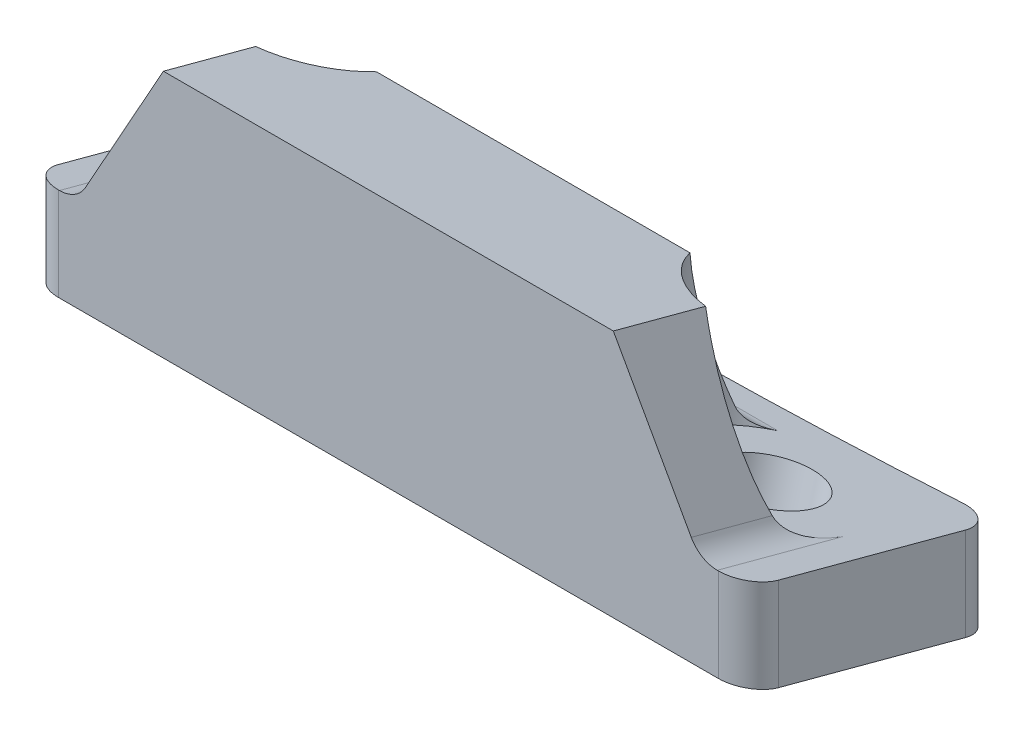
from build123d import *

# Parameters (mm, degrees)
BOSS_EXTRU_1_DEPTH            = 12
ESQUISSE2_R                   = 1.55
ENL_V_MAT_EXTRU_1_DEPTH       = 16.94179588
ENL_V_START                   = -3
ESQUISSE3_R                   = 3
ENL_V_MAT_EXTRU_2_DEPTH       = 25
ENL_V_MAT_EXTRU_3_DEPTH       = 16.94179588
ENL_V_MAT_EXTRU_3_DEPTH_BACK  = 16.94179588
ESQUISSE4_R                   = 125
ENL_V_START_2                 = -12
ENL_V_MAT_EXTRU_4_DEPTH       = 1.613248654
ENL_V_START_3                 = 10.386751346
ENL_V_MAT_EXTRU_4_2_DEPTH     = 1.613248654
ENL_V_START_4                 = -4.63527657
ENL_V_MAT_EXTRU_4_3_OUTLINE_W = 24
ENL_V_MAT_EXTRU_4_3_OUTLINE_H = 5
ENL_V_MAT_EXTRU_4_3_DEPTH     = 2.892118763
ENL_V_START_5                 = -1.893983464
ENL_V_MAT_EXTRU_4_4_DEPTH     = 8.893983464
ENL_V_START_6                 = -7.5
ENL_V_MAT_EXTRU_4_5_DEPTH     = 15
CONG_1_R                      = 1


with BuildPart() as part:
    # Esquisse1 → Boss.-Extru.1 (new, symmetric)
    with BuildSketch(Plane(origin=(0, 0, 0), x_dir=(0, 0, -1), z_dir=(1, 0, 0))):
        Polygon((-3.863703305, 1.03527618), (4.829629131, -1.294095226), (4.829629131, 6.988114218), (-3.863703305, 9.317485624), align=None)
    extrude(amount=BOSS_EXTRU_1_DEPTH, both=True)

    # Esquisse2 → Enlèv. mat.-Extru.1 (cut, through all)
    with BuildSketch(Plane(origin=(0, 0, 0), x_dir=(1, 0, 0), z_dir=(0, -0.9659258262890672, 0.2588190451025247))):
        with Locations(Location((-8, 0, 0), (0, 0, 270))):
            Circle(ESQUISSE2_R)
        with Locations(Location((8, 0, 0), (0, 0, 270))):
            Circle(ESQUISSE2_R)
    extrude(amount=-ENL_V_MAT_EXTRU_1_DEPTH, mode=Mode.SUBTRACT)

    # Esquisse3 → Enlèv. mat.-Extru.2 (cut)
    with BuildSketch(Plane(origin=(0, 0, 0), x_dir=(1, 0, 0), z_dir=(0, -0.9659258262890672, 0.2588190451025247)).offset(ENL_V_START)):
        with Locations(Location((-8, 0, 0), (0, 0, 270))):
            Circle(ESQUISSE3_R)
        with Locations(Location((8, 0, 0), (0, 0, 270))):
            Circle(ESQUISSE3_R)
    extrude(amount=-ENL_V_MAT_EXTRU_2_DEPTH, mode=Mode.SUBTRACT)

    # Esquisse4 → Enlèv. mat.-Extru.3 (cut, two sides: drawn at the far end of the back side and taken through both)
    with BuildSketch(Plane(origin=(0, 0, 0), x_dir=(1, 0, 0), z_dir=(0, 1, 0)).offset(-ENL_V_MAT_EXTRU_3_DEPTH_BACK)):
        with Locations((0, 128.9)):
            Circle(ESQUISSE4_R)
    extrude(amount=ENL_V_MAT_EXTRU_3_DEPTH + ENL_V_MAT_EXTRU_3_DEPTH_BACK, mode=Mode.SUBTRACT)

    # Enlèv. mat.-Extru.4: read off the stored shape, not the designer's step
    # Enlèv. mat.-Extru.4 outline → Enlèv. mat.-Extru.4 (cut)
    with BuildSketch(Plane.YZ.offset(ENL_V_START_2)):
        Polygon((9.317485624, 3.863703305), (4.141104722, 3.863703305), (2.44661504, -2.46021828), (8.023390398, -0.965925826), align=None)
    extrude(amount=ENL_V_MAT_EXTRU_4_DEPTH, mode=Mode.SUBTRACT)

    # Enl_v. mat.-Extru.4 2 outline → Enl_v. mat.-Extru.4 2 (cut)
    with BuildSketch(Plane.YZ.offset(ENL_V_START_3)):
        Polygon((9.317485624, 3.863703305), (4.141104722, 3.863703305), (2.44661504, -2.46021828), (8.023390398, -0.965925826), align=None)
    extrude(amount=ENL_V_MAT_EXTRU_4_2_DEPTH, mode=Mode.SUBTRACT)

    # Enl_v. mat.-Extru.4 3 outline → Enl_v. mat.-Extru.4 3 (cut)
    with BuildSketch(Plane(origin=(0, 0, 0), x_dir=(1, 0, 0), z_dir=(0, 0.25881904510252507, 0.9659258262890671)).offset(ENL_V_START_4)):
        with Locations((0, 5.5)):
            Rectangle(ENL_V_MAT_EXTRU_4_3_OUTLINE_W, ENL_V_MAT_EXTRU_4_3_OUTLINE_H)
    extrude(amount=ENL_V_MAT_EXTRU_4_3_DEPTH, mode=Mode.SUBTRACT)

    # Enl_v. mat.-Extru.4 4 outline → Enl_v. mat.-Extru.4 4 (cut)
    with BuildSketch(Plane(origin=(0, 0, 0), x_dir=(1, 0, 0), z_dir=(0, 0.25881904510252507, 0.9659258262890671)).offset(ENL_V_START_5)):
        Polygon((-12, 8), (-12, 3), (-10.386751346, 3), (-7.5, 8), align=None)
        Polygon((12, 8), (7.5, 8), (10.386751346, 3), (12, 3), align=None)
    extrude(amount=ENL_V_MAT_EXTRU_4_4_DEPTH, mode=Mode.SUBTRACT)

    # Enl_v. mat.-Extru.4 5 outline → Enl_v. mat.-Extru.4 5 (cut)
    with BuildSketch(Plane.YZ.offset(ENL_V_START_6)):
        Polygon((7.276244171, -3.754313506), (8.023390398, -0.965925826), (2.44661504, -2.46021828), align=None)
    extrude(amount=ENL_V_MAT_EXTRU_4_5_DEPTH, mode=Mode.SUBTRACT)

    # Congé1
    # the kernel refuses this fillet: 1 mm, written as the material it adds along each edge
    with BuildSketch(Plane(origin=(-10.386751346, 4.514677836, 5.257897145), x_dir=(-1, 0, 0), z_dir=(0, -0.2588190451454881, -0.9659258262775553))) as cong_1_piece_1_section:
        with BuildLine():
            CenterArc((CONG_1_R * 0.577350268999, CONG_1_R), CONG_1_R, 210, 60)
            Line((-CONG_1_R * 0.288675134782, CONG_1_R * 0.499999999993), (0, 0))
            Line((0, 0), (CONG_1_R * 0.577350268999, 0))
        make_face()
    cong_1_piece_1 = extrude(amount=5.873068178, mode=Mode.PRIVATE)
    cong_1_piece_1 = split(cong_1_piece_1, bisect_by=Plane(origin=(-10.386751346, 4.514677836, 3.863703305), z_dir=(0, 0, -1)), keep=Keep.TOP, mode=Mode.PRIVATE)
    cong_1_piece_1 = cong_1_piece_1 - Plane(origin=(-8, 2.897777479, -0.776457135), x_dir=(0, -0.25881904510252474, -0.9659258262890673), z_dir=(0, -0.9659258262890673, 0.25881904510252474)) * Cylinder(3, 15, mode=Mode.PRIVATE)
    add(cong_1_piece_1)
    with BuildSketch(Plane(origin=(-7.00177766, 2.44661504, -2.46021828), x_dir=(0, -0.2588190451025249, -0.9659258262890672), z_dir=(1, 0, 0))) as cong_1_piece_2_section:
        with BuildLine():
            CenterArc((CONG_1_R * 0.577350268769, CONG_1_R), CONG_1_R, 210.000000004, 59.999999996)
            Line((-CONG_1_R * 0.288675134977, CONG_1_R * 0.499999999934), (0, 0))
            Line((0, 0), (CONG_1_R * 0.577350268769, 0))
        make_face()
    cong_1_piece_2 = extrude(amount=14.003555319, mode=Mode.PRIVATE)
    cong_1_piece_2 = cong_1_piece_2 - Plane(origin=(-8, 2.897777479, -0.776457135), x_dir=(0, -0.25881904510252474, -0.9659258262890673), z_dir=(0, -0.9659258262890673, 0.25881904510252474)) * Cylinder(3, 31, mode=Mode.PRIVATE)
    cong_1_piece_2 = cong_1_piece_2 - Plane(origin=(8, 2.897777479, -0.776457135), x_dir=(0, -0.25881904510252474, -0.9659258262890673), z_dir=(0, -0.9659258262890673, 0.25881904510252474)) * Cylinder(3, 31, mode=Mode.PRIVATE)
    add(cong_1_piece_2)
    with BuildSketch(Plane(origin=(10.386751346, 4.514677836, 5.257897145), x_dir=(-0.5000000002478059, 0.8365163035896415, -0.22414386804219472), z_dir=(0, -0.2588190451454881, -0.9659258262775553))) as cong_1_piece_3_section:
        with BuildLine():
            CenterArc((CONG_1_R * 0.577350268999, CONG_1_R), CONG_1_R, 210.000000016, 60)
            Line((-CONG_1_R * 0.288675134643, CONG_1_R * 0.499999999752), (0, 0))
            Line((0, 0), (CONG_1_R * 0.577350269277, 0))
        make_face()
    cong_1_piece_3 = extrude(amount=5.873068178, mode=Mode.PRIVATE)
    cong_1_piece_3 = split(cong_1_piece_3, bisect_by=Plane(origin=(10.386751346, 4.514677836, 3.863703305), z_dir=(0, 0, -1)), keep=Keep.TOP, mode=Mode.PRIVATE)
    cong_1_piece_3 = cong_1_piece_3 - Plane(origin=(8, 2.897777479, -0.776457135), x_dir=(0, -0.25881904510252474, -0.9659258262890673), z_dir=(0, -0.9659258262890673, 0.25881904510252474)) * Cylinder(3, 15, mode=Mode.PRIVATE)
    add(cong_1_piece_3)
    # the kernel refuses this fillet: 1 mm, written as the material it takes off along each edge
    with BuildSketch(Plane(origin=(12, 6.641104722, 3.863703305), x_dir=(0, 0, -1), z_dir=(0, -1, 0))) as cong_1_2_piece_1:
        with BuildLine():
            CenterArc((CONG_1_R, -CONG_1_R), CONG_1_R, 90, 90)
            Line((0, -CONG_1_R), (0, 0))
            Line((0, 0), (CONG_1_R, 0))
        make_face()
    extrude(amount=8.105828542, mode=Mode.SUBTRACT)
    with BuildSketch(Plane(origin=(-12, 6.641104722, 3.863703305), x_dir=(0, 0, -1), z_dir=(0, -1, 0))) as cong_1_2_piece_2:
        with BuildLine():
            CenterArc((CONG_1_R, CONG_1_R), CONG_1_R, 180, 90)
            Line((0, CONG_1_R), (0, 0))
            Line((0, 0), (CONG_1_R, 0))
        make_face()
    extrude(amount=8.105828542, mode=Mode.SUBTRACT)
    with BuildSketch(Plane(origin=(-12, -3.940338157, -4.477333255), x_dir=(0, 0, 1), z_dir=(0, 1, 0))) as cong_1_2_piece_3:
        with BuildLine():
            CenterArc((1.096256131, 1), CONG_1_R, 174.991611749, 95.008388251)
            ThreePointArc((0.100074203, 1.087301587), (0.051224329, 0.543541522), (0, 0))
            Line((0, 0), (1.096256131, 0))
        make_face()
    extrude(amount=8.587109196, mode=Mode.SUBTRACT)
    with BuildSketch(Plane(origin=(12, -3.940338157, -4.477333255), x_dir=(-0.9957911285935623, 0, 0.09165166782093803), z_dir=(0, 1, 0))) as cong_1_2_piece_4:
        with BuildLine():
            CenterArc((1.096264831, 0.999990462), CONG_1_R, 174.741366539, 95.008388251)
            Line((0.100473703, 1.09164213), (0, 0))
            ThreePointArc((0, 0), (0.545948621, 0.001192245), (1.091897242, 0))
        make_face()
    extrude(amount=8.587109196, mode=Mode.SUBTRACT)


solid = part.part
